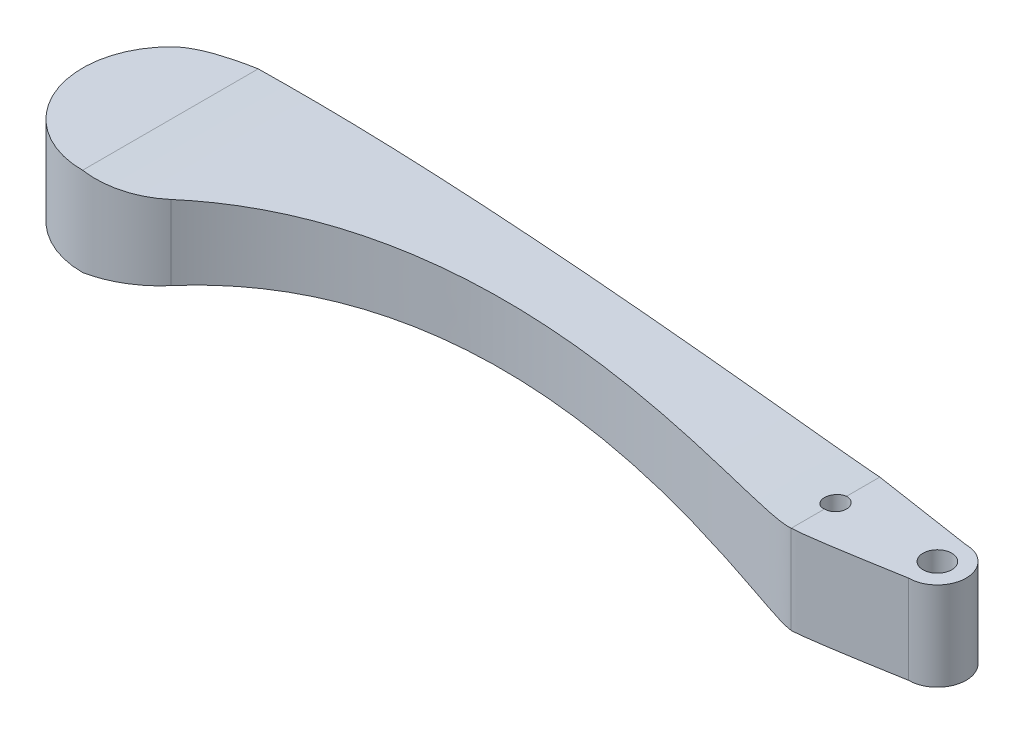
from build123d import *

# Parameters (mm, degrees)
BOSS_EXTRUDE1_DEPTH      = 20
BOSS_EXTRUDE1_DEPTH_BACK = 20
SKETCH1_R                = 5
SKETCH1_R_2              = 6.5
CUT_EXTRUDE2_DEPTH       = 50
CUT_EXTRUDE2_DEPTH_BACK  = 50


with BuildPart() as part:
    # Sketch1 → Boss-Extrude1 (new, two sides: drawn at the far end of the back side and taken through both)
    with BuildSketch(Plane(origin=(0, 0, 0), x_dir=(1, 0, 0), z_dir=(0, 1, 0)).offset(-BOSS_EXTRUDE1_DEPTH_BACK)):
        with BuildLine():
            ThreePointArc((-328.284271247, 28.284271247), (-328.284271247, -28.284271247), (-271.715728753, -28.284271247))
            add(Edge.make_bspline(
                [(-271.715728753, -28.284271247), (-189.219937614, 54.211519891), (-20, -20), (3.938998468, -20), (19.272331802, -17.666666667), (46, -13)],
                knots=[0, 0, 0, 0, 1, 1, 1.196949923, 1.196949923, 1.196949923, 1.196949923], degree=3))
            ThreePointArc((46, -13), (59, 0), (46, 13))
            add(Edge.make_bspline(
                [(46, 13), (0.03150303, 20), (0, 20)],
                knots=[0.358766717, 0.358766717, 0.358766717, 1.358766717, 1.358766717, 1.358766717], degree=2))
            add(Edge.make_bspline(
                [(0, 20), (-114.873131821, 40.378289836), (-300, 56.568542495), (-328.284271247, 28.284271247)],
                knots=[0.1900067, 0.1900067, 0.1900067, 0.1900067, 1.1900067, 1.1900067, 1.1900067, 1.1900067], degree=3))
        make_face()
        Circle(SKETCH1_R, mode=Mode.SUBTRACT)
        with Locations((46, 0)):
            Circle(SKETCH1_R_2, mode=Mode.SUBTRACT)
    extrude(amount=BOSS_EXTRUDE1_DEPTH + BOSS_EXTRUDE1_DEPTH_BACK)

    # Sketch3 → Cut-Extrude2 (cut, two sides: drawn at the far end of the back side and taken through both)
    with BuildSketch(Plane.XY.offset(-CUT_EXTRUDE2_DEPTH_BACK)):
        with BuildLine():
            add(Edge.make_bspline(
                [(-300, -20), (-244.111917171, -10.63873359), (-66.276139157, -12.794597658), (0, -20)],
                knots=[0, 0, 0, 0, 1, 1, 1, 1], degree=3))
            Line((-300, -20), (0, -20))
        make_face()
        with BuildLine():
            Line((0, 20), (-300, 20))
            add(Edge.make_bspline(
                [(-300, 20), (-244.111917171, 10.63873359), (-66.276139157, 12.794597658), (0, 20)],
                knots=[0, 0, 0, 0, 1, 1, 1, 1], degree=3))
        make_face()
    extrude(amount=CUT_EXTRUDE2_DEPTH + CUT_EXTRUDE2_DEPTH_BACK, mode=Mode.SUBTRACT)


solid = part.part
